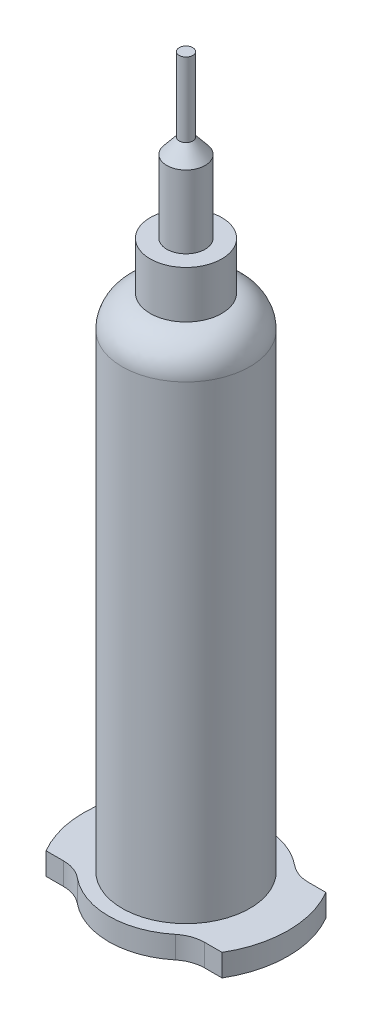
from build123d import *

# Parameters (mm, degrees)
FILLET1_R           = 5
BOSS_EXTRUDE1_DEPTH = 3.4
SCALE1_SCALE_X      = 1.05
SCALE1_SCALE_Y      = 1.01
SCALE1_SCALE_Z      = 1.05


with BuildPart() as part:
    # Sketch2 → Revolve1 (revolve)
    with BuildSketch(Plane.XY, mode=Mode.PRIVATE) as revolve1_sk:
        Polygon((1, 54.38), (0, 54.38), (0, -54.38), (9.4, -54.38), (9.4, 22.38), (5.275, 22.38), (5.275, 29.62), (2.825, 29.62), (2.825, 40.74), (1, 43.03), align=None)
    revolve(revolve1_sk.sketch.rotate(Axis((0, 24.52235385, 0), (0, -1, 0)), 90), axis=Axis((0, 24.52235385, 0), (0, -1, 0)))

    # Fillet1
    # the kernel refuses this fillet: 5 mm, written as the material it takes off along each edge
    with BuildSketch(Plane(origin=(0, 22.38, 0), x_dir=(0, 0, 1), z_dir=(1, 0, 0))) as fillet1_piece_1:
        with BuildLine():
            CenterArc((4.4, 4.922842167), FILLET1_R, 280.078658108, 79.921341892)
            Line((5.275, 0), (5.2925, -0.098456843))
            ThreePointArc((5.2925, -0.098456843), (7.3375, -0.1), (9.4, -0.1))
            Line((9.4, -0.1), (9.5, 0))
            Line((9.5, 0), (9.5, 4.922842167))
            Line((9.5, 4.922842167), (9.4, 4.922842167))
        make_face()
    revolve(axis=Axis((0, 22.38, 0), (0, -1, 0)), mode=Mode.SUBTRACT)

    # Sketch4 → Boss-Extrude1 (add)
    with BuildSketch(Plane.XZ.offset(54.38)):
        with BuildLine():
            Line((-12.960709857, 7.65), (-10.397986584, 7.65))
            ThreePointArc((-10.397986584, 7.65), (-8.71171512, 7.942932064), (-7.223028848, 8.78740458))
            ThreePointArc((-7.223028848, 8.78740458), (0, 11.375), (7.223028848, 8.78740458))
            ThreePointArc((7.223028848, 8.78740458), (8.71171512, 7.942932064), (10.397986584, 7.65))
            Line((10.397986584, 7.65), (12.960709857, 7.65))
            ThreePointArc((12.960709857, 7.65), (15.05, 0), (12.960709857, -7.65))
            Line((12.960709857, -7.65), (10.397986584, -7.65))
            ThreePointArc((10.397986584, -7.65), (8.71171512, -7.942932064), (7.223028848, -8.78740458))
            ThreePointArc((7.223028848, -8.78740458), (0, -11.375), (-7.223028848, -8.78740458))
            ThreePointArc((-7.223028848, -8.78740458), (-8.71171512, -7.942932064), (-10.397986584, -7.65))
            Line((-10.397986584, -7.65), (-12.960709857, -7.65))
            ThreePointArc((-12.960709857, -7.65), (-15.05, 0), (-12.960709857, 7.65))
        make_face()
    extrude(amount=BOSS_EXTRUDE1_DEPTH)


with BuildPart() as part_1:
    # Scale1: scaled about (0, 0, 0)
    add(part.part.scale((SCALE1_SCALE_X, SCALE1_SCALE_Y, SCALE1_SCALE_Z), about=(0, 0, 0)))


solid = part_1.part
